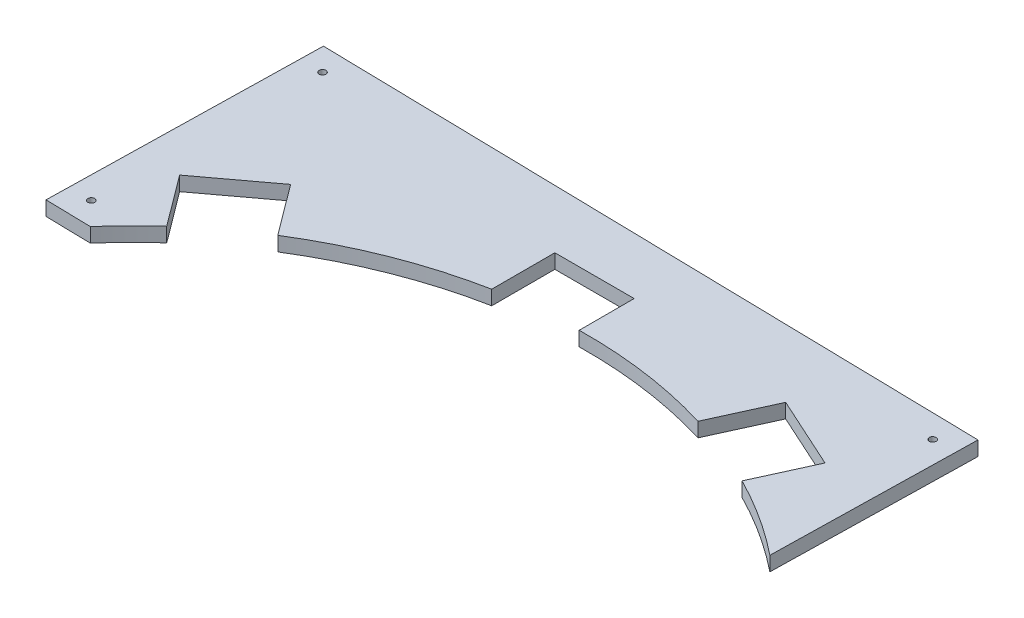
from build123d import *

# Parameters (mm, degrees)
SKETCH1_R           = 1.5
BOSS_EXTRUDE1_DEPTH = 6.35


with BuildPart() as part:
    # Sketch1 → Boss-Extrude1 (new body)
    with BuildSketch(Plane(origin=(0, 0, 0), x_dir=(1, 0, 0), z_dir=(0, 1, 0))):
        with BuildLine():
            Line((-12.884325045, 57.589892951), (-32.880086413, 58.0016299))
            Line((-32.880086413, 58.0016299), (-30.409664718, 177.976198108))
            Line((-30.409664718, 177.976198108), (264.52781546, 171.903078107))
            Line((264.52781546, 171.903078107), (262.674606435, 81.903078107))
            ThreePointArc((262.674606435, 81.903078107), (245.966301841, 93.936578204), (228.109303454, 104.188415872))
            Line((228.109303454, 104.188415872), (239.565645069, 129.341286502))
            Line((239.565645069, 129.341286502), (207.713903894, 143.848752998))
            Line((207.713903894, 143.848752998), (195.598020496, 117.247831174))
            ThreePointArc((195.598020496, 117.247831174), (165.438476431, 123.896281605), (134.614931972, 125.822183564))
            Line((134.614931972, 125.822183564), (134.614931972, 150.073013143))
            Line((134.614931972, 150.073013143), (99.614931972, 150.073013143))
            Line((99.614931972, 150.073013143), (99.614931972, 122.205605467))
            ThreePointArc((99.614931972, 122.205605467), (64.494604203, 112.00765114), (31.818351454, 95.585160423))
            Line((31.818351454, 95.585160423), (15.189825734, 117.890629233))
            Line((15.189825734, 117.890629233), (-12.870789642, 96.971693679))
            Line((-12.870789642, 96.971693679), (3.847059798, 74.546406222))
            ThreePointArc((3.847059798, 74.546406222), (-4.771312567, 66.317474746), (-12.884325045, 57.589892951))
        make_face()
        with Locations((-20.617652508, 167.77244895)):
            Circle(SKETCH1_R, mode=Mode.SUBTRACT)
        with Locations((254.324066301, 162.111065898)):
            Circle(SKETCH1_R, mode=Mode.SUBTRACT)
        with Locations((-22.676337254, 67.79364211)):
            Circle(SKETCH1_R, mode=Mode.SUBTRACT)
    extrude(amount=BOSS_EXTRUDE1_DEPTH)


solid = part.part
